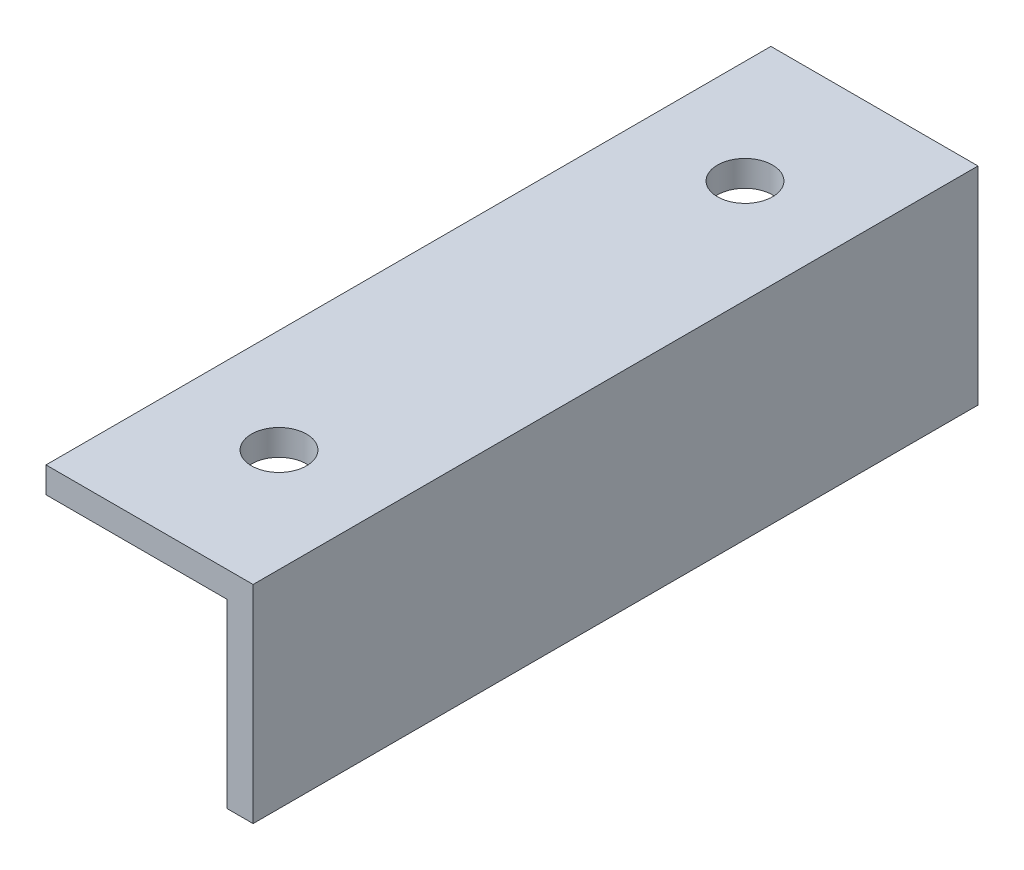
from build123d import *

# Parameters (mm, degrees)
BOSS_EXTRUDE1_DEPTH = 88.9
SKETCH2_R           = 3.3782
CUT_EXTRUDE1_DEPTH  = 96.882897328


with BuildPart() as part:
    # Sketch1 → Boss-Extrude1 (new body)
    with BuildSketch(Plane.XY):
        Polygon((0, 0), (0, 25.4), (-25.4, 25.4), (-25.4, 22.225), (-3.175, 22.225), (-3.175, 0), align=None)
    extrude(amount=BOSS_EXTRUDE1_DEPTH)

    # Sketch2 → Cut-Extrude1 (cut, through all)
    with BuildSketch(Plane(origin=(0, 25.4, 0), x_dir=(1, 0, 0), z_dir=(0, 1, 0))):
        with Locations((-12.7, -15.875)):
            Circle(SKETCH2_R)
        with Locations((-12.7, -73.025)):
            Circle(SKETCH2_R)
    extrude(amount=-CUT_EXTRUDE1_DEPTH, mode=Mode.SUBTRACT)


solid = part.part
